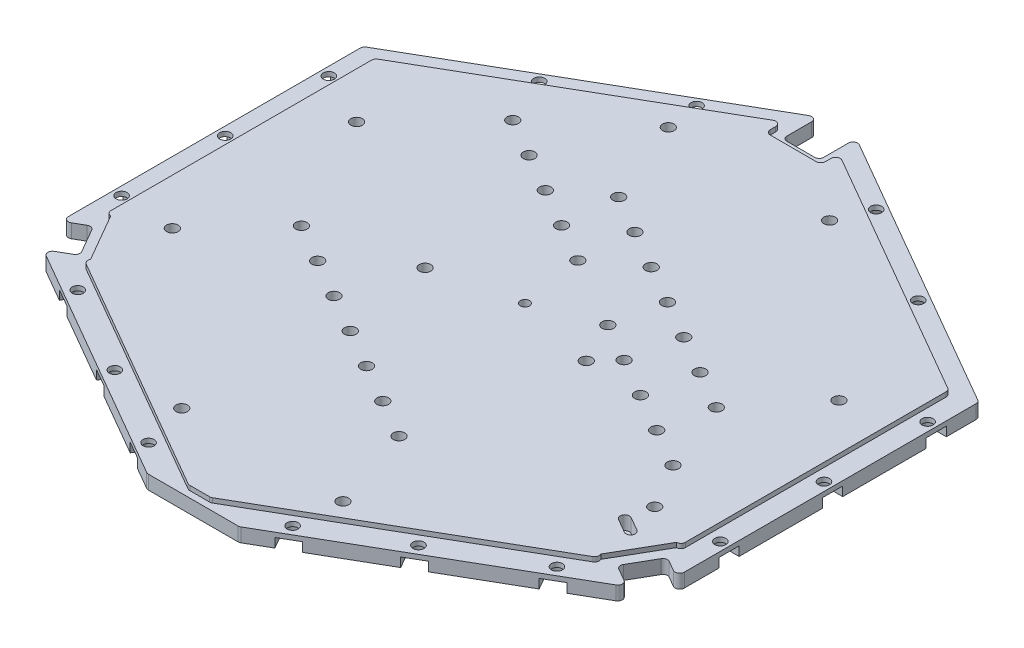
from build123d import *

# Parameters (mm, degrees)
BOSS_EXTRUDE1_DEPTH            = 4
CUT_EXTRUDE1_REACH             = 104.962
CUT_EXTRUDE3_DEPTH             = 1
SKETCH8_R                      = 1
CUT_EXTRUDE5_DEPTH             = 3
CUT_EXTRUDE4_DEPTH             = 3
CUT_EXTRUDE7_DEPTH             = 99.673898731
TAP_DRILL_FOR_M3X0_5_TAP1_D    = 2.5
TAP_DRILL_FOR_M3X0_5_TAP2_D    = 2.5
CHAMFER1_SIZE                  = 2.8
CBORE_FOR_M2_SHCS2_D           = 2.4
CBORE_FOR_M2_SHCS2_CBORE_D     = 4.4
CBORE_FOR_M2_SHCS2_CBORE_DEPTH = 2
SKETCH15_W                     = 12
SKETCH15_H                     = 14.8
CUT_EXTRUDE6_DEPTH             = 1
FILLET1_R                      = 1
CUT_EXTRUDE8_DEPTH             = 2


with BuildPart() as part:
    # Sketch1 → Boss-Extrude1 (new body)
    with BuildSketch(Plane(origin=(0, 0, 0), x_dir=(1, 0, 0), z_dir=(0, 1, 0))):
        Polygon((-67.353829072, -38.886751346), (0, -77.773502692), (67.353829072, -38.886751346), (67.353829072, 38.886751346), (0, 77.773502692), (-67.353829072, 38.886751346), align=None)
    extrude(amount=BOSS_EXTRUDE1_DEPTH)

    # Sketch2 → Cut-Extrude1 (cut, up to next)
    with BuildSketch(Plane(origin=(0, 4, 0), x_dir=(1, 0, 0), z_dir=(0, 1, 0)), mode=Mode.PRIVATE) as cut_extrude1_sk1:
        Polygon((-67.353829072, 38.886751346), (-67.353829072, 31.958548116), (0, 70.845299462), (67.353829072, 31.958548116), (67.353829072, 38.886751346), (0, 77.773502692), align=None)
    cut_extrude1_tool1 = extrude(cut_extrude1_sk1.sketch, amount=-CUT_EXTRUDE1_REACH, mode=Mode.PRIVATE) & part.part
    add(cut_extrude1_tool1.solids().sort_by_distance((-65.930974, 4, -35.42265))[0], mode=Mode.SUBTRACT)

    # Sketch4 → Cut-Extrude3 (cut)
    with BuildSketch(Plane(origin=(0, 4, 0), x_dir=(1, 0, 0), z_dir=(0, 1, 0))):
        Polygon((-67.353829072, 31.958548116), (-67.353829072, -38.886751346), (0, -77.773502692), (67.353829072, -38.886751346), (67.353829072, 31.958548116), (0, 70.845299462), align=None)
        Polygon((62.353829072, 29.649147039), (62.353829072, -36), (0, -72), (-62.353829072, -36), (-62.353829072, 29.649147039), (0, 65.649147039), align=None, mode=Mode.SUBTRACT)
    extrude(amount=-CUT_EXTRUDE3_DEPTH, mode=Mode.SUBTRACT)

    # Sketch8 → Cut-Extrude5 (cut)
    with BuildSketch(Plane(origin=(0, 4, 0), x_dir=(1, 0, 0), z_dir=(0, 1, 0))):
        with Locations(Location((0, 0, 0), (0, 0, 270))):
            Circle(SKETCH8_R)
        with BuildLine():
            Line((53.843094087, -32.241025404), (50.812005174, -30.491025404))
            ThreePointArc((50.812005174, -30.491025404), (50.44597977, -29.125), (51.812005174, -28.758974596))
            Line((51.812005174, -28.758974596), (54.843094087, -30.508974596))
            ThreePointArc((54.843094087, -30.508974596), (55.209119491, -31.875), (53.843094087, -32.241025404))
        make_face()
    extrude(amount=-CUT_EXTRUDE5_DEPTH, mode=Mode.SUBTRACT)

    # Sketch5 → Cut-Extrude4 (cut)
    with BuildSketch(Plane.XZ):
        Polygon((0, 77.773502692), (10, 72), (-10, 72), align=None)
        Polygon((-4, -68.535898385), (-4, -59.885898385), (4, -59.885898385), (4, -68.535898385), (0, -70.845299462), align=None)
        Polygon((67.353829072, 38.886751346), (63.353829072, 41.196152423), (58.304900968, 38.281152423), (62.304900968, 31.352949192), (67.353829072, 34.267949192), align=None)
        Polygon((-67.353829072, 38.886751346), (-67.353829072, 34.267949192), (-62.304900968, 31.352949192), (-58.304900968, 38.281152423), (-63.353829072, 41.196152423), align=None)
    extrude(amount=-CUT_EXTRUDE4_DEPTH, mode=Mode.SUBTRACT)

    # Sketch16 → Cut-Extrude7 (cut, through all)
    with BuildSketch(Plane.XZ):
        Polygon((67.353829072, 38.886751346), (66.853829072, 39.175426481), (66.853829072, -31.669872981), (0, -70.267949192), (-66.853829072, -31.669872981), (-66.853829072, 39.175426481), (-67.353829072, 38.886751346), (-67.353829072, -31.958548116), (0, -70.845299462), (67.353829072, -31.958548116), align=None)
    extrude(amount=-CUT_EXTRUDE7_DEPTH, mode=Mode.SUBTRACT)

    # Tap Drill for M3x0.5 Tap1 (through all)
    with Locations(Plane(origin=(0, 4, 0), x_dir=(1, 0, 0), z_dir=(0, 1, 0))):
        with Locations((11.332797781, -38.655018452), (46.533560093, -14.397509662), (40.353561401, 1.195565652), (2.973920584, -33.829018452), (-5.384956614, -29.003018452), (-13.743833811, -24.177018452), (-22.102711008, -19.351018452), (-30.461588206, -14.525018452), (-38.820465403, -9.699018452), (38.174682895, -9.571509662), (29.815805698, -4.745509662), (21.456928501, 0.080490338), (13.098051303, 4.906490338), (-2.299880376, 13.796490338), (-10.658757573, 18.622490338), (-19.017634771, 23.448490338), (-27.376511968, 28.274490338), (-35.735389165, 33.100490338), (31.994684204, 6.021565652), (23.635807007, 10.847565652), (15.276929809, 15.673565652), (6.918052612, 20.499565652), (-1.440824585, 25.325565652), (-9.799701783, 30.151565652)):
            Hole(TAP_DRILL_FOR_M3X0_5_TAP1_D / 2)

    # Tap Drill for M3x0.5 Tap2 (through all)
    with Locations(Plane(origin=(0, 0, 0), x_dir=(-1, 0, 0), z_dir=(0, -1, 0))):
        with Locations((-17.5, 48.637), (17.5, 48.637), (-52.353829072, 15.8185), (-52.353829072, -24.1815), (-17.5, -57), (17.5, -57), (52.353829072, 15.8185), (52.353829072, -24.1815), (17.5, -4.1815), (-17.5, -4.1815)):
            Hole(TAP_DRILL_FOR_M3X0_5_TAP2_D / 2)

    # Chamfer1
    chamfer1_edges = [part.edges().sort_by_distance(p)[0] for p in [
        (0, 3.5, 72),
    ]]
    chamfer(chamfer1_edges, length=CHAMFER1_SIZE)

    # CBORE for M2 SHCS2 (through all)
    with Locations(Plane(origin=(0, 0, 79.328), x_dir=(-1, 0, 0), z_dir=(0, -1, 0))):
        with Locations((-65, 101.748729811), (-41.13620668, 123.578548116), (-19.485571585, 136.078548116), (19.485571585, 136.078548116), (41.13620668, 123.578548116), (65, 101.768729811), (65, 79.268729811), (65, 56.768729811), (52.009618943, 34.268729811), (32.95706006, 23.268729811), (15.636551984, 13.268729811), (-15.636551984, 13.268729811), (-32.95706006, 23.268729811), (-52.009618943, 34.268729811), (-65, 56.748729811), (-65, 79.248729811)):
            CounterBoreHole(CBORE_FOR_M2_SHCS2_D / 2, CBORE_FOR_M2_SHCS2_CBORE_D / 2, CBORE_FOR_M2_SHCS2_CBORE_DEPTH)

    # Sketch15 → Cut-Extrude6 (cut)
    with BuildSketch(Plane(origin=(0, 4, 0), x_dir=(1, 0, 0), z_dir=(0, 1, 0))):
        with Locations((0, 65.649147039)):
            Rectangle(SKETCH15_W, SKETCH15_H)
        Polygon((-63.320225422, -43.486152423), (-55.387432723, -38.906152423), (-61.387432723, -28.513847577), (-69.320225422, -33.093847577), align=None)
        Polygon((61.387432723, -28.513847577), (69.320225422, -33.093847577), (63.320225422, -43.486152423), (55.387432723, -38.906152423), align=None)
    extrude(amount=-CUT_EXTRUDE6_DEPTH, mode=Mode.SUBTRACT)

    # Fillet1
    # the kernel refuses this fillet: 1 mm, written as the material it adds along each edge
    with BuildSketch(Plane(origin=(4, 0, -59.885898385), x_dir=(-1, 0, 0), z_dir=(0, 1, 0)), Plane(origin=(-4, 0, -59.885898385), x_dir=(0, 0, -1), z_dir=(0, 1, 0)), Plane(origin=(58.304900968, 0, 38.281152423), x_dir=(0.499999999999999, 0, -0.8660254037844393), z_dir=(0, 1, 0)), Plane(origin=(62.304900968, 0, 31.352949192), x_dir=(0.8660254037844393, 0, 0.499999999999999), z_dir=(0, 1, 0)), Plane(origin=(-58.304900968, 0, 38.281152423), x_dir=(-0.8660254037844393, 0, 0.499999999999999), z_dir=(0, 1, 0)), Plane(origin=(-62.304900968, 0, 31.352949192), x_dir=(0.5000000000000021, 0, 0.8660254037844375), z_dir=(0, 1, 0))) as fillet1_piece_1:
        with BuildLine():
            CenterArc((FILLET1_R, -FILLET1_R), FILLET1_R, 90, 90)
            Line((0, -FILLET1_R), (0, 0))
            Line((0, 0), (FILLET1_R, 0))
        make_face()
    extrude(amount=3)
    with BuildSketch(Plane(origin=(6, 4, -58.249147039), x_dir=(0, 0, -1), z_dir=(0, -1, 0)), Plane(origin=(-6, 4, -58.249147039), x_dir=(1, 0, 0), z_dir=(0, -1, 0))) as fillet1_piece_2:
        with BuildLine():
            CenterArc((FILLET1_R, -FILLET1_R), FILLET1_R, 90, 90)
            Line((0, -FILLET1_R), (0, 0))
            Line((0, 0), (FILLET1_R, 0))
        make_face()
    extrude(amount=3.5)
    # the kernel refuses this fillet: 1 mm, written as the material it takes off along each edge
    with BuildSketch(Plane(origin=(62.353829072, 5.443375673, -29.649147039), x_dir=(0, 0, 1), z_dir=(0, -1, 0)), Plane(origin=(-62.353829072, 5.443375673, -29.649147039), x_dir=(0.8660254037844372, 0, -0.5000000000000026), z_dir=(0, -1, 0))) as fillet1_2_piece_1:
        with BuildLine():
            CenterArc((FILLET1_R * 0.57735026919, FILLET1_R), FILLET1_R, 210, 60)
            Line((-FILLET1_R * 0.288675134595, FILLET1_R * 0.5), (0, 0))
            Line((0, 0), (FILLET1_R * 0.57735026919, 0))
        make_face()
    extrude(amount=2.443375673, mode=Mode.SUBTRACT)
    with BuildSketch(Plane(origin=(10, -0.669872981, 72), x_dir=(-1, 0, 0), z_dir=(0, 1, 0))) as fillet1_2_piece_2:
        with BuildLine():
            CenterArc((FILLET1_R * 0.267949192431, -FILLET1_R), FILLET1_R, 90, 30)
            Line((-FILLET1_R * 0.232050807569, -FILLET1_R * 0.133974596216), (0, 0))
            Line((0, 0), (FILLET1_R * 0.267949192431, 0))
        make_face()
    extrude(amount=4.339745962, mode=Mode.SUBTRACT)
    with BuildSketch(Plane(origin=(-10, -0.669872981, 72), x_dir=(1, 0, 0), z_dir=(0, 1, 0))) as fillet1_2_piece_3:
        with BuildLine():
            CenterArc((FILLET1_R * 0.267949192431, FILLET1_R), FILLET1_R, 240, 30)
            Line((-FILLET1_R * 0.232050807569, FILLET1_R * 0.133974596216), (0, 0))
            Line((0, 0), (FILLET1_R * 0.267949192431, 0))
        make_face()
    extrude(amount=4.339745962, mode=Mode.SUBTRACT)
    with BuildSketch(Plane(origin=(66.853829072, -1.443375673, -31.669872981), x_dir=(0, 0, 1), z_dir=(0, 1, 0))) as fillet1_2_piece_4:
        with BuildLine():
            CenterArc((FILLET1_R * 0.57735026919, -FILLET1_R), FILLET1_R, 90, 60)
            Line((-FILLET1_R * 0.288675134595, -FILLET1_R * 0.5), (0, 0))
            Line((0, 0), (FILLET1_R * 0.57735026919, 0))
        make_face()
    extrude(amount=5.886751346, mode=Mode.SUBTRACT)
    with BuildSketch(Plane(origin=(-66.853829072, -1.443375673, -31.669872981), x_dir=(0, 0, 1), z_dir=(0, 1, 0))) as fillet1_2_piece_5:
        with BuildLine():
            CenterArc((FILLET1_R * 0.57735026919, FILLET1_R), FILLET1_R, 210, 60)
            Line((-FILLET1_R * 0.288675134595, FILLET1_R * 0.5), (0, 0))
            Line((0, 0), (FILLET1_R * 0.57735026919, 0))
        make_face()
    extrude(amount=5.886751346, mode=Mode.SUBTRACT)
    with BuildSketch(Plane(origin=(4, -4.330127019, -67.958548116), x_dir=(0.8660254037844365, 0, 0.5000000000000038), z_dir=(0, 1, 0)), Plane(origin=(-4, 7.330127019, -67.958548116), x_dir=(-0.8660254037844398, 0, 0.49999999999999795), z_dir=(0, -1, 0)), Plane(origin=(63.353829072, -4.330127019, 41.196152423), x_dir=(-0.8660254037844429, 0, 0.4999999999999926), z_dir=(0, 1, 0)), Plane(origin=(66.853829072, -4.330127019, 33.979274058), x_dir=(-0.8660254037844398, 0, -0.49999999999999795), z_dir=(0, 1, 0)), Plane(origin=(-66.853829072, 7.330127019, 33.979274058), x_dir=(0.866025403784438, 0, -0.500000000000001), z_dir=(0, -1, 0))) as fillet1_2_piece_6:
        with BuildLine():
            CenterArc((FILLET1_R * 1.73205080757, -FILLET1_R), FILLET1_R, 90, 120)
            Line((FILLET1_R * 0.866025403784, -FILLET1_R * 1.5), (0, 0))
            Line((0, 0), (FILLET1_R * 1.73205080757, 0))
        make_face()
    extrude(amount=11.660254038, mode=Mode.SUBTRACT)
    with BuildSketch(Plane(origin=(6, 3, -62.185045424), x_dir=(0.8660254037844387, 0, 0.49999999999999994), z_dir=(0, 1, 0))) as fillet1_2_piece_7:
        with BuildLine():
            CenterArc((FILLET1_R * 1.73205080757, -FILLET1_R), FILLET1_R, 90, 120)
            Line((FILLET1_R * 0.866025403784, -FILLET1_R * 1.5), (0, 0))
            Line((0, 0), (FILLET1_R * 1.73205080757, 0))
        make_face()
    extrude(amount=5.330127019, mode=Mode.SUBTRACT)
    with BuildSketch(Plane(origin=(-6, 8.330127019, -62.185045424), x_dir=(0, 0, 1), z_dir=(0, -1, 0))) as fillet1_2_piece_8:
        with BuildLine():
            CenterArc((FILLET1_R * 1.73205080757, FILLET1_R), FILLET1_R, 150, 120)
            Line((FILLET1_R * 0.866025403784, FILLET1_R * 1.5), (0, 0))
            Line((0, 0), (FILLET1_R * 1.73205080757, 0))
        make_face()
    extrude(amount=5.330127019, mode=Mode.SUBTRACT)
    with BuildSketch(Plane(origin=(-2.424871131, 4.669872981, 70.6), x_dir=(1, 0, 0), z_dir=(0, -1, 0))) as fillet1_2_piece_9:
        with BuildLine():
            CenterArc((FILLET1_R * 0.267949192431, -FILLET1_R), FILLET1_R, 90, 30)
            Line((-FILLET1_R * 0.232050807569, -FILLET1_R * 0.133974596216), (0, 0))
            Line((0, 0), (FILLET1_R * 0.267949192431, 0))
        make_face()
    extrude(amount=1.669872981, mode=Mode.SUBTRACT)
    with BuildSketch(Plane(origin=(2.424871131, 4.669872981, 70.6), x_dir=(-1, 0, 0), z_dir=(0, -1, 0))) as fillet1_2_piece_10:
        with BuildLine():
            CenterArc((FILLET1_R * 0.267949192431, FILLET1_R), FILLET1_R, 240, 30)
            Line((-FILLET1_R * 0.232050807569, FILLET1_R * 0.133974596216), (0, 0))
            Line((0, 0), (FILLET1_R * 0.267949192431, 0))
        make_face()
    extrude(amount=1.669872981, mode=Mode.SUBTRACT)
    with BuildSketch(Plane(origin=(56.353829072, 7.893461076, 39.464101615), x_dir=(-0.8660254037844383, 0, 0.5000000000000006), z_dir=(0, -1, 0))) as fillet1_2_piece_11:
        with BuildLine():
            CenterArc((1.55738443, 1), FILLET1_R, 181.925709896, 88.074290104)
            Line((0.557949192, 0.966396349), (0, 0))
            Line((0, 0), (1.55738443, 0))
        make_face()
    extrude(amount=4.893461076, mode=Mode.SUBTRACT)
    with BuildSketch(Plane(origin=(62.353829072, 3, 29.07179677), x_dir=(-0.8660254037844096, 0, -0.5000000000000503), z_dir=(0, 1, 0))) as fillet1_2_piece_12:
        with BuildLine():
            CenterArc((1.644717619, -0.84873448), FILLET1_R, 121.925709896, 88.074290104)
            Line((0.778692215, -1.34873448), (0, 0))
            Line((0, 0), (1.115898385, 0))
        make_face()
    extrude(amount=4.893461076, mode=Mode.SUBTRACT)
    with BuildSketch(Plane(origin=(-62.353829072, 3, 29.07179677), x_dir=(0, 0, -1), z_dir=(0, 1, 0))) as fillet1_2_piece_13:
        with BuildLine():
            CenterArc((1.55738443, -1), FILLET1_R, 90, 88.074290104)
            Line((0.557949192, -0.966396349), (0, 0))
            Line((0, 0), (1.55738443, 0))
        make_face()
    extrude(amount=4.893461076, mode=Mode.SUBTRACT)
    with BuildSketch(Plane(origin=(-56.353829072, 7.893461076, 39.464101615), x_dir=(0.8660254037844785, 0, -0.49999999999993083), z_dir=(0, -1, 0))) as fillet1_2_piece_14:
        with BuildLine():
            CenterArc((1.644717619, 0.84873448), FILLET1_R, 150, 88.074290104)
            Line((0.778692215, 1.34873448), (0, 0))
            Line((0, 0), (1.115898385, 0))
        make_face()
    extrude(amount=4.893461076, mode=Mode.SUBTRACT)
    with BuildSketch(Plane(origin=(-63.353829072, -4.330127019, 41.196152423), x_dir=(0.8660254037844388, 0, 0.4999999999999997), z_dir=(0, 1, 0))) as fillet1_2_piece_15:
        with BuildLine():
            CenterArc((FILLET1_R * 1.73205080757, FILLET1_R), FILLET1_R, 150, 120)
            Line((FILLET1_R * 0.866025403784, FILLET1_R * 1.5), (0, 0))
            Line((0, 0), (FILLET1_R * 1.73205080757, 0))
        make_face()
    extrude(amount=11.660254038, mode=Mode.SUBTRACT)

    # Sketch17 → Cut-Extrude8 (cut)
    with BuildSketch(Plane.XZ):
        with BuildLine():
            Line((-65, 24.759270189), (-66.853829072, 24.759270189))
            Line((-66.853829072, 24.759270189), (-66.853829072, 20.359270189))
            Line((-66.853829072, 20.359270189), (-65, 20.359270189))
            ThreePointArc((-65, 20.359270189), (-62.8, 22.559270189), (-65, 24.759270189))
        make_face()
        with BuildLine():
            Line((21.390827473, -55.650548116), (22.37264094, -57.351098923))
            Line((22.37264094, -57.351098923), (18.562129163, -59.551098923))
            Line((18.562129163, -59.551098923), (17.580315697, -57.850548116))
            ThreePointArc((17.580315697, -57.850548116), (18.385571585, -54.845292227), (21.390827473, -55.650548116))
        make_face()
        with BuildLine():
            Line((-65, 2.259270189), (-66.853829072, 2.259270189))
            Line((-66.853829072, 2.259270189), (-66.853829072, -2.140729811))
            Line((-66.853829072, -2.140729811), (-65, -2.140729811))
            ThreePointArc((-65, -2.140729811), (-62.8, 0.059270189), (-65, 2.259270189))
        make_face()
        with BuildLine():
            Line((-65, -20.240729811), (-66.853829072, -20.240729811))
            Line((-66.853829072, -20.240729811), (-66.853829072, -24.640729811))
            Line((-66.853829072, -24.640729811), (-65, -24.640729811))
            ThreePointArc((-65, -24.640729811), (-62.8, -22.440729811), (-65, -20.240729811))
        make_face()
        with BuildLine():
            Line((66.853829072, -24.640729811), (66.853829072, -20.240729811))
            Line((66.853829072, -20.240729811), (65, -20.240729811))
            ThreePointArc((65, -20.240729811), (62.8, -22.440729811), (65, -24.640729811))
            Line((65, -24.640729811), (66.853829072, -24.640729811))
        make_face()
        with BuildLine():
            Line((66.853829072, -2.140729811), (66.853829072, 2.259270189))
            Line((66.853829072, 2.259270189), (65, 2.259270189))
            ThreePointArc((65, 2.259270189), (62.8, 0.059270189), (65, -2.140729811))
            Line((65, -2.140729811), (66.853829072, -2.140729811))
        make_face()
        with BuildLine():
            Line((66.853829072, 20.359270189), (66.853829072, 24.759270189))
            Line((66.853829072, 24.759270189), (65, 24.759270189))
            ThreePointArc((65, 24.759270189), (62.8, 22.559270189), (65, 20.359270189))
            Line((65, 20.359270189), (66.853829072, 20.359270189))
        make_face()
        with BuildLine():
            Line((43.041462568, -43.150548116), (44.023276035, -44.851098923))
            Line((44.023276035, -44.851098923), (40.212764258, -47.051098923))
            Line((40.212764258, -47.051098923), (39.230950791, -45.350548116))
            ThreePointArc((39.230950791, -45.350548116), (40.03620668, -42.345292227), (43.041462568, -43.150548116))
        make_face()
        with BuildLine():
            Line((53.914874832, 43.959270189), (55.078148302, 45.974118943))
            Line((55.078148302, 45.974118943), (51.267636525, 48.174118943))
            Line((51.267636525, 48.174118943), (50.104363055, 46.159270189))
            ThreePointArc((50.104363055, 46.159270189), (50.909618943, 43.154014301), (53.914874832, 43.959270189))
        make_face()
        with BuildLine():
            Line((34.862315948, 54.959270189), (36.025589419, 56.974118943))
            Line((36.025589419, 56.974118943), (32.215077642, 59.174118943))
            Line((32.215077642, 59.174118943), (31.051804172, 57.159270189))
            ThreePointArc((31.051804172, 57.159270189), (31.85706006, 54.154014301), (34.862315948, 54.959270189))
        make_face()
        with BuildLine():
            Line((17.541807873, 64.959270189), (18.705081343, 66.974118943))
            Line((18.705081343, 66.974118943), (14.894569566, 69.174118943))
            Line((14.894569566, 69.174118943), (13.731296096, 67.159270189))
            ThreePointArc((13.731296096, 67.159270189), (14.536551984, 64.154014301), (17.541807873, 64.959270189))
        make_face()
        with BuildLine():
            Line((-14.894569566, 69.174118943), (-13.731296096, 67.159270189))
            ThreePointArc((-13.731296096, 67.159270189), (-14.536551984, 64.154014301), (-17.541807873, 64.959270189))
            Line((-17.541807873, 64.959270189), (-18.705081343, 66.974118943))
            Line((-18.705081343, 66.974118943), (-14.894569566, 69.174118943))
        make_face()
        with BuildLine():
            Line((-32.215077642, 59.174118943), (-31.051804172, 57.159270189))
            ThreePointArc((-31.051804172, 57.159270189), (-31.85706006, 54.154014301), (-34.862315948, 54.959270189))
            Line((-34.862315948, 54.959270189), (-36.025589419, 56.974118943))
            Line((-36.025589419, 56.974118943), (-32.215077642, 59.174118943))
        make_face()
        with BuildLine():
            Line((-51.267636525, 48.174118943), (-50.104363055, 46.159270189))
            ThreePointArc((-50.104363055, 46.159270189), (-50.909618943, 43.154014301), (-53.914874832, 43.959270189))
            Line((-53.914874832, 43.959270189), (-55.078148302, 45.974118943))
            Line((-55.078148302, 45.974118943), (-51.267636525, 48.174118943))
        make_face()
        with BuildLine():
            Line((-40.212764258, -47.051098923), (-39.230950791, -45.350548116))
            ThreePointArc((-39.230950791, -45.350548116), (-40.03620668, -42.345292227), (-43.041462568, -43.150548116))
            Line((-43.041462568, -43.150548116), (-44.023276035, -44.851098923))
            Line((-44.023276035, -44.851098923), (-40.212764258, -47.051098923))
        make_face()
        with BuildLine():
            Line((-18.562129163, -59.551098923), (-17.580315697, -57.850548116))
            ThreePointArc((-17.580315697, -57.850548116), (-18.385571585, -54.845292227), (-21.390827473, -55.650548116))
            Line((-21.390827473, -55.650548116), (-22.37264094, -57.351098923))
            Line((-22.37264094, -57.351098923), (-18.562129163, -59.551098923))
        make_face()
    extrude(amount=-CUT_EXTRUDE8_DEPTH, mode=Mode.SUBTRACT)


solid = part.part
